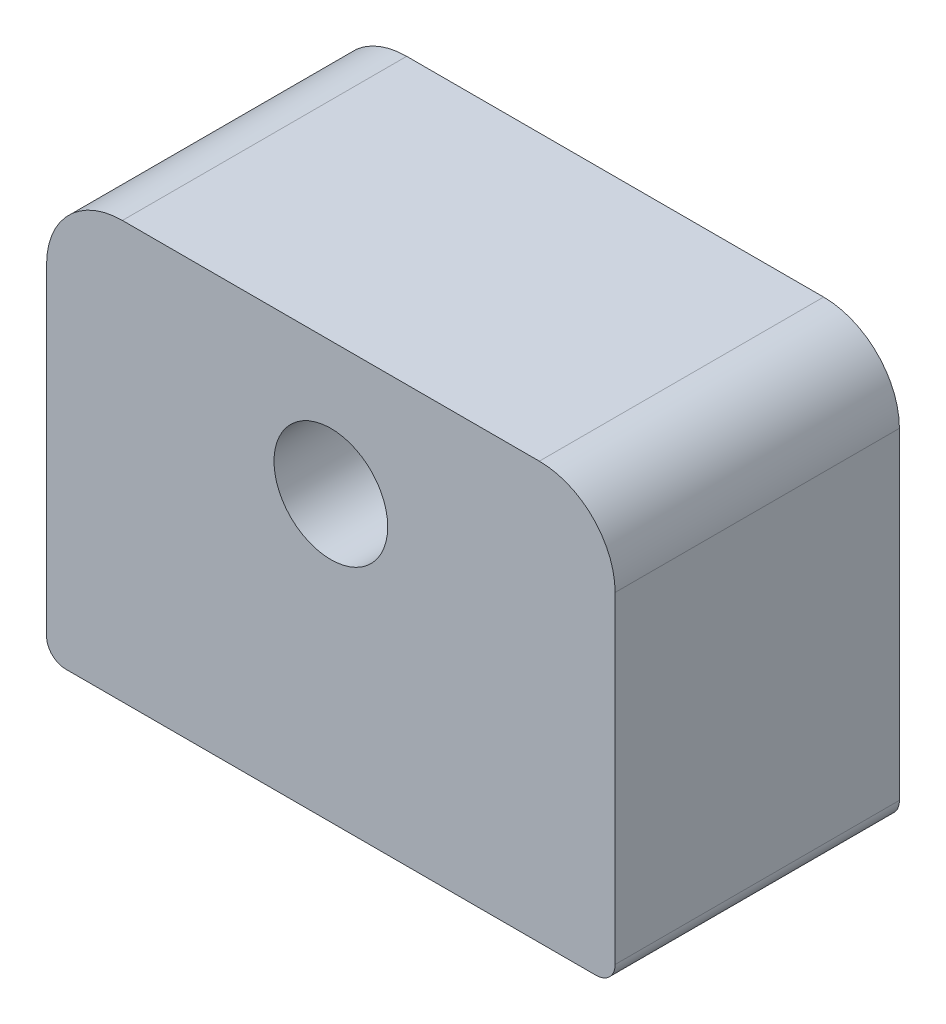
from build123d import *

# Parameters (mm, degrees)
ESQUISSE1_W             = 15
ESQUISSE1_H             = 11
BOSS_EXTRU_1_DEPTH      = 7.5
ESQUISSE2_R             = 1.5
ENL_V_MAT_EXTRU_1_DEPTH = 12.947803145
CONG_1_R                = 2
CONG_2_R                = 0.5


with BuildPart() as part:
    # Esquisse1 → Boss.-Extru.1 (new body)
    with BuildSketch(Plane.XY):
        Rectangle(ESQUISSE1_W, ESQUISSE1_H)
    extrude(amount=BOSS_EXTRU_1_DEPTH)

    # Esquisse2 → Enlèv. mat.-Extru.1 (cut, through all)
    with BuildSketch(Plane.XY.offset(7.5)):
        with Locations((0, 2)):
            Circle(ESQUISSE2_R)
    extrude(amount=-ENL_V_MAT_EXTRU_1_DEPTH, mode=Mode.SUBTRACT)

    # Congé1
    cong_1_edges = [part.edges().sort_by_distance(p)[0] for p in [
        (7.5, 5.5, 3.75),
        (-7.5, 5.5, 3.75),
    ]]
    fillet(cong_1_edges, radius=CONG_1_R)

    # Congé2
    cong_2_edges = [part.edges().sort_by_distance(p)[0] for p in [
        (7.5, -5.5, 3.75),
        (-7.5, -5.5, 3.75),
    ]]
    fillet(cong_2_edges, radius=CONG_2_R)


solid = part.part
